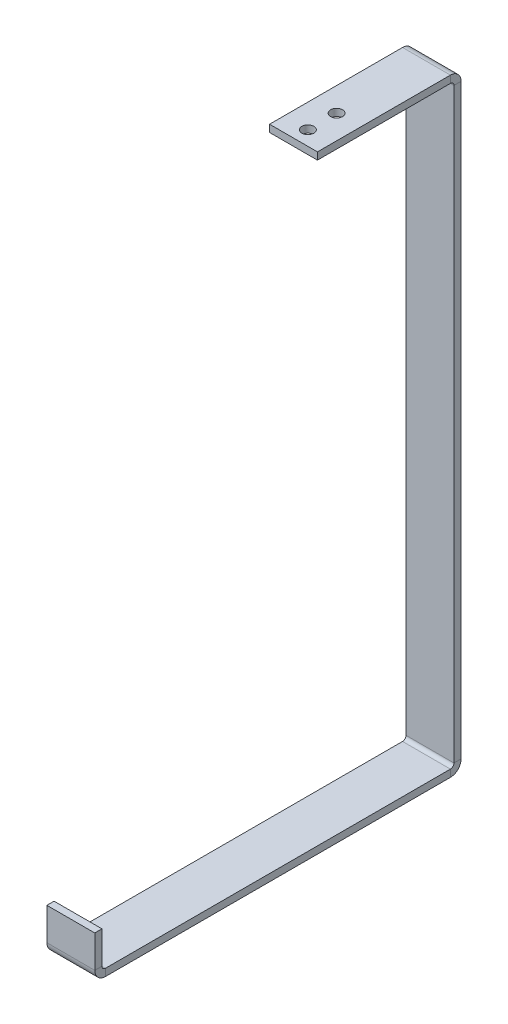
from build123d import *

# Parameters (mm, degrees)
SKETCH1_W                    = 10
SKETCH1_H                    = 7.500039556
BASE_FLANGE1_DEPTH           = 1.5
EDGE_FLANGE1_STRIP_W         = 7.4732
EDGE_FLANGE1_STRIP_H         = 1.5
EDGE_FLANGE1_STRIP_CUT_DEPTH = 10
EDGE_FLANGE1_DEPTH           = 10
EDGE_FLANGE2_STRIP_W         = 7.4732
EDGE_FLANGE2_STRIP_H         = 1.5
EDGE_FLANGE2_STRIP_CUT_DEPTH = 10
EDGE_FLANGE2_DEPTH           = 10
EDGE_FLANGE3_STRIP_W         = 7.4732
EDGE_FLANGE3_STRIP_H         = 1.5
EDGE_FLANGE3_STRIP_CUT_DEPTH = 10
EDGE_FLANGE3_DEPTH           = 10
CUT_EXTRUDE1_REACH           = 165.692
SKETCH15_R                   = 1.25


# Sheet-metal steps are written as plain solids
with BuildPart() as part:
    # Sketch1 → Base-Flange1 (new body)
    with BuildSketch(Plane.XY):
        with Locations((-66, -195.249980222)):
            Rectangle(SKETCH1_W, SKETCH1_H)
    extrude(amount=BASE_FLANGE1_DEPTH)

    # Edge-Flange1 strip (across the edge) → Edge-Flange1 strip cut (cut)
    with BuildSketch(Plane(origin=(-61, -199, 0), x_dir=(0, 1, 0), z_dir=(-1, 0, 0))):
        with Locations((-3, -0.75)):
            Rectangle(EDGE_FLANGE1_STRIP_W, EDGE_FLANGE1_STRIP_H)
    extrude(amount=EDGE_FLANGE1_STRIP_CUT_DEPTH, mode=Mode.SUBTRACT)

    # Edge-Flange1 section (across the edge) → Edge-Flange1 (add)
    with BuildSketch(Plane(origin=(-61, -199, 0), x_dir=(0, 1, 0), z_dir=(-1, 0, 0))):
        with BuildLine():
            Line((-1.5, 0.7366), (-1.5, 73.5))
            Line((-1.5, 73.5), (0, 73.5))
            Line((0, 73.5), (0, 0.7366))
            ThreePointArc((0, 0.7366), (0.215745145, 0.215745145), (0.7366, 0))
            Line((0.7366, 0), (0.7366, -1.5))
            ThreePointArc((0.7366, -1.5), (-0.844915027, -0.844915027), (-1.5, 0.7366))
        make_face()
    extrude(amount=EDGE_FLANGE1_DEPTH)

    # Edge-Flange2 strip (across the edge) → Edge-Flange2 strip cut (cut)
    with BuildSketch(Plane(origin=(-61, -199, -73.5), x_dir=(0, 0, 1), z_dir=(-1, 0, 0))):
        with Locations((-3, -0.75)):
            Rectangle(EDGE_FLANGE2_STRIP_W, EDGE_FLANGE2_STRIP_H)
    extrude(amount=EDGE_FLANGE2_STRIP_CUT_DEPTH, mode=Mode.SUBTRACT)

    # Edge-Flange2 section (across the edge) → Edge-Flange2 (add)
    with BuildSketch(Plane(origin=(-61, -199, -73.5), x_dir=(0, 0, 1), z_dir=(-1, 0, 0))):
        with BuildLine():
            Line((-1.5, 0.7366), (-1.5, 124))
            Line((-1.5, 124), (0, 124))
            Line((0, 124), (0, 0.7366))
            ThreePointArc((0, 0.7366), (0.215745145, 0.215745145), (0.7366, 0))
            Line((0.7366, 0), (0.7366, -1.5))
            ThreePointArc((0.7366, -1.5), (-0.844915027, -0.844915027), (-1.5, 0.7366))
        make_face()
    extrude(amount=EDGE_FLANGE2_DEPTH)

    # Edge-Flange3 strip (across the edge) → Edge-Flange3 strip cut (cut)
    with BuildSketch(Plane(origin=(-61, -75, -73.5), x_dir=(0, -1, 0), z_dir=(-1, 0, 0))):
        with Locations((-3, -0.75)):
            Rectangle(EDGE_FLANGE3_STRIP_W, EDGE_FLANGE3_STRIP_H)
    extrude(amount=EDGE_FLANGE3_STRIP_CUT_DEPTH, mode=Mode.SUBTRACT)

    # Edge-Flange3 section (across the edge) → Edge-Flange3 (add)
    with BuildSketch(Plane(origin=(-61, -75, -73.5), x_dir=(0, -1, 0), z_dir=(-1, 0, 0))):
        with BuildLine():
            Line((-1.5, 0.7366), (-1.5, 28.5))
            Line((-1.5, 28.5), (0, 28.5))
            Line((0, 28.5), (0, 0.7366))
            ThreePointArc((0, 0.7366), (0.215745145, 0.215745145), (0.7366, 0))
            Line((0.7366, 0), (0.7366, -1.5))
            ThreePointArc((0.7366, -1.5), (-0.844915027, -0.844915027), (-1.5, 0.7366))
        make_face()
    extrude(amount=EDGE_FLANGE3_DEPTH)

    # Sketch15 → Cut-Extrude1 (cut, up to next)
    with BuildSketch(Plane(origin=(0, -73.5, 0), x_dir=(1, 0, 0), z_dir=(0, 1, 0)), mode=Mode.PRIVATE) as cut_extrude1_sk1:
        with Locations(Location((-66, 48, 0), (0, 0, 270))):
            Circle(SKETCH15_R)
    cut_extrude1_tool1 = extrude(cut_extrude1_sk1.sketch, amount=-CUT_EXTRUDE1_REACH, mode=Mode.PRIVATE) & part.part
    # Sketch15 → Cut-Extrude1 (cut, up to next)
    with BuildSketch(Plane(origin=(0, -73.5, 0), x_dir=(1, 0, 0), z_dir=(0, 1, 0)), mode=Mode.PRIVATE) as cut_extrude1_sk2:
        with Locations(Location((-66, 54, 0), (0, 0, 270))):
            Circle(SKETCH15_R)
    cut_extrude1_tool2 = extrude(cut_extrude1_sk2.sketch, amount=-CUT_EXTRUDE1_REACH, mode=Mode.PRIVATE) & part.part
    add(cut_extrude1_tool1.solids().sort_by_distance((-66, -73.5, -48))[0], mode=Mode.SUBTRACT)
    add(cut_extrude1_tool2.solids().sort_by_distance((-66, -73.5, -54))[0], mode=Mode.SUBTRACT)


solid = part.part
